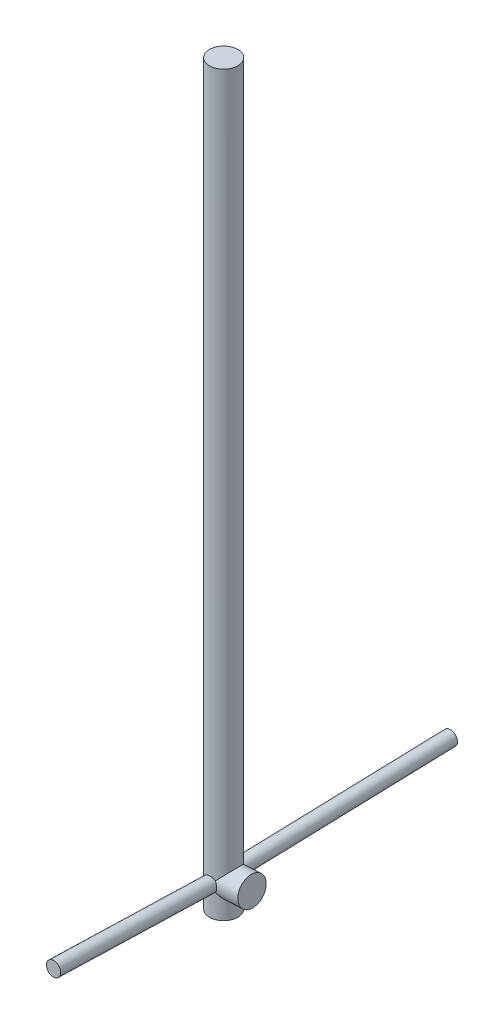
from build123d import *

# Parameters (mm, degrees)
SWEEP_100_PROFILE_R = 50
SWEEP_515_PROFILE_R = 25
SWEEP_585_PROFILE_R = 25
SWEEP_641_PROFILE_R = 50


with BuildPart() as part:
    # труба 100: sweep along a curve in space
    with BuildLine() as sweep_100_path:
        Line((0, -100, 0), (0, 2500, 0))
    # труба 100 profile (on start of the path) → труба 100 (sweep)
    with BuildSketch(Plane.ZX.offset(-100)):
        Circle(SWEEP_100_PROFILE_R)
    sweep(path=sweep_100_path.line)

    # Sweep 515: sweep along a curve in space
    with BuildLine() as sweep_515_path:
        Line((0, 18, 599.729939223), (0, 0, 0))
    # Sweep 515 profile (on start of the path) → Sweep 515 (sweep)
    with BuildSketch(Plane(origin=(0, 18, 599.729939223), x_dir=(0, -0.9995498987044119, 0.030000000000000002), z_dir=(0, -0.030000000000000002, -0.9995498987044119))):
        Circle(SWEEP_515_PROFILE_R)
    sweep(path=sweep_515_path.line)



with BuildPart() as body_2:
    # Sweep 585: sweep along a curve in space
    with BuildLine() as sweep_585_path:
        Line((0, 0, 0), (0, 24, -799.639918964))
    # Sweep 585 profile (on start of the path) → Sweep 585 (sweep)
    with BuildSketch(Plane(origin=(0, 0, 0), x_dir=(0, -0.9995498987044119, -0.03), z_dir=(0, 0.03, -0.9995498987044119))):
        Circle(SWEEP_585_PROFILE_R)
    sweep(path=sweep_585_path.line)


with BuildPart() as part_1:
    add(part.part)

    add(body_2.part)  # Sweep 641 merges body 2
    # Sweep 641: sweep along a curve in space
    with BuildLine() as sweep_641_path:
        Line((0, 0, 0), (99.874921777, 5, 0))
    # Sweep 641 profile (on start of the path) → Sweep 641 (sweep)
    with BuildSketch(Plane(origin=(0, 0, 0), x_dir=(-0.04999999999999999, 0.998749217771909, 0), z_dir=(0.998749217771909, 0.04999999999999999, 0))):
        Circle(SWEEP_641_PROFILE_R)
    sweep(path=sweep_641_path.line)


solid = part_1.part
